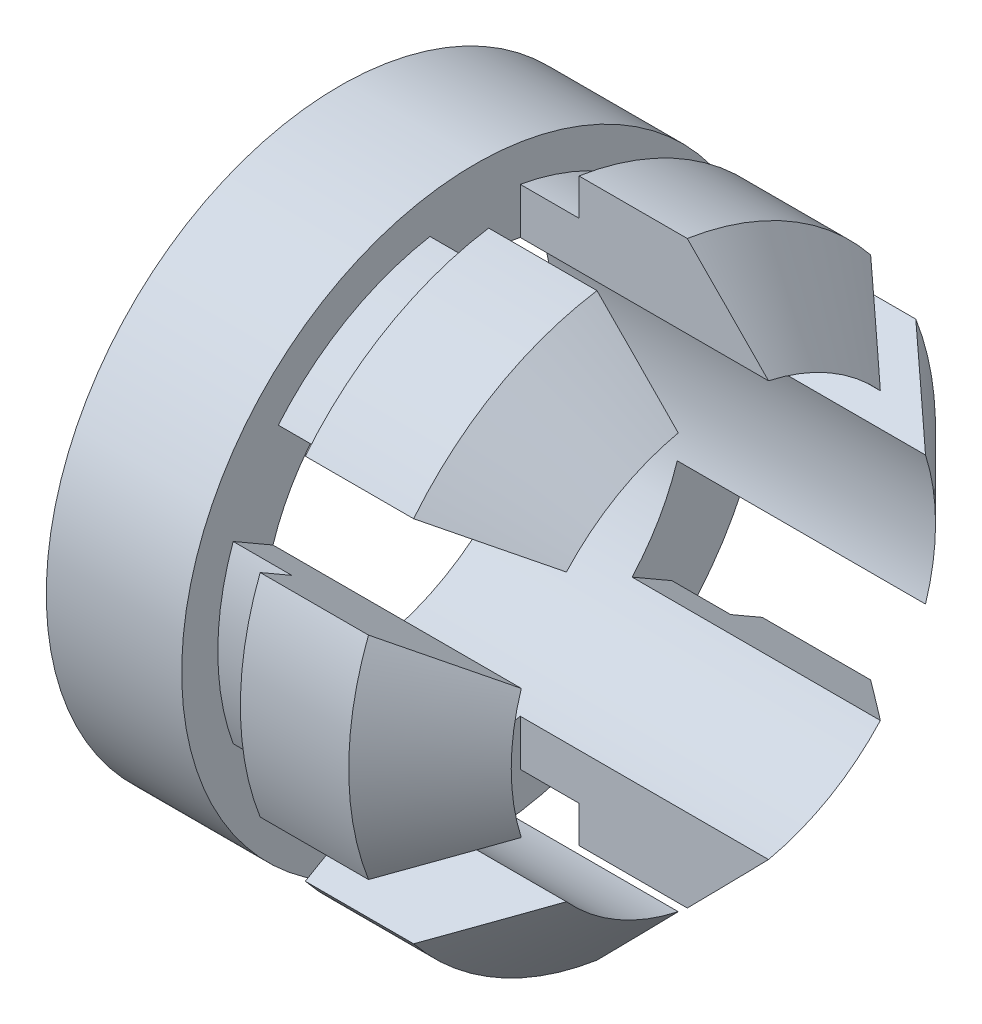
from build123d import *

# Parameters (mm, degrees)
SKETCH_1_R               = 6.5
SKETCH_1_R_2             = 4.7
EXTRUDE_1_DEPTH          = 8.5
SKETCH_2_W               = 1.3
SKETCH_2_H               = 0.8
SKETCH_4_W               = 2
SKETCH_4_H               = 13
CUT_EXTRUDE_1_DEPTH      = 8.5
PATTERN_START            = 3
PATTERN_CIRCULAR_1_DEPTH = 5.5000001


# Read off the part's stored shape, not the designer's step: Круговой массив1
with BuildPart() as part:
    # Эскиз1 → Вытянуть1 (new body)
    with BuildSketch(Plane(origin=(0, 0, 0), x_dir=(0, 0, -1), z_dir=(1, 0, 0))):
        Circle(SKETCH_1_R)
        Circle(SKETCH_1_R_2, mode=Mode.SUBTRACT)
    extrude(amount=EXTRUDE_1_DEPTH)

    # Эскиз2 → Вырез-Повернуть1 (revolve, cut)
    with BuildSketch(Plane.XY, mode=Mode.PRIVATE) as cut_revolve_1_sk:
        with Locations((3.65, 6.1)):
            Rectangle(SKETCH_2_W, SKETCH_2_H)
    revolve(cut_revolve_1_sk.sketch.rotate(Axis((8.5, 0, 0), (-1, 0, 0)), 90), axis=Axis((8.5, 0, 0), (-1, 0, 0)), mode=Mode.SUBTRACT)

    # Эскиз3 → Вырез-Повернуть2 (revolve, cut)
    with BuildSketch(Plane.XY, mode=Mode.PRIVATE) as cut_revolve_2_sk:
        Polygon((8.5, 4.7), (6.7, 6.5), (8.5, 6.5), align=None)
    revolve(cut_revolve_2_sk.sketch.rotate(Axis((8.5, 0, 0), (-1, 0, 0)), 90), axis=Axis((8.5, 0, 0), (-1, 0, 0)), mode=Mode.SUBTRACT)

    # Эскиз4 → Вырез-Вытянуть1 (cut)
    with BuildSketch(Plane(origin=(3, 0, 0), x_dir=(0, 0, -1), z_dir=(1, 0, 0))):
        Rectangle(SKETCH_4_W, SKETCH_4_H)
    extrude(amount=CUT_EXTRUDE_1_DEPTH, mode=Mode.SUBTRACT)

    # Круговой массив1 outline → Круговой массив1 (cut)
    with BuildSketch(Plane.YZ.offset(PATTERN_START)):
        with BuildLine():
            ThreePointArc((3.162217904, -3.477122075), (2.35, -4.070319398), (1.430167097, -4.477122075))
            Line((1.430167097, -4.477122075), (2.345282741, -6.062148865))
            ThreePointArc((2.345282741, -6.062148865), (3.25, -5.629165125), (4.077333548, -5.062148865))
            Line((4.077333548, -5.062148865), (3.162217904, -3.477122075))
        make_face()
        with BuildLine():
            ThreePointArc((-1.430167097, -4.477122075), (-2.35, -4.070319398), (-3.162217904, -3.477122075))
            Line((-3.162217904, -3.477122075), (-4.077333548, -5.062148865))
            ThreePointArc((-4.077333548, -5.062148865), (-3.25, -5.629165125), (-2.345282741, -6.062148865))
            Line((-2.345282741, -6.062148865), (-1.430167097, -4.477122075))
        make_face()
        with BuildLine():
            ThreePointArc((1.430167097, 4.477122075), (2.35, 4.070319398), (3.162217904, 3.477122075))
            Line((3.162217904, 3.477122075), (4.077333548, 5.062148865))
            ThreePointArc((4.077333548, 5.062148865), (3.25, 5.629165125), (2.345282741, 6.062148865))
            Line((2.345282741, 6.062148865), (1.430167097, 4.477122075))
        make_face()
        with BuildLine():
            ThreePointArc((-3.162217904, 3.477122075), (-2.35, 4.070319398), (-1.430167097, 4.477122075))
            Line((-1.430167097, 4.477122075), (-2.345282741, 6.062148865))
            ThreePointArc((-2.345282741, 6.062148865), (-3.25, 5.629165125), (-4.077333548, 5.062148865))
            Line((-4.077333548, 5.062148865), (-3.162217904, 3.477122075))
        make_face()
    extrude(amount=PATTERN_CIRCULAR_1_DEPTH, mode=Mode.SUBTRACT)


solid = part.part
